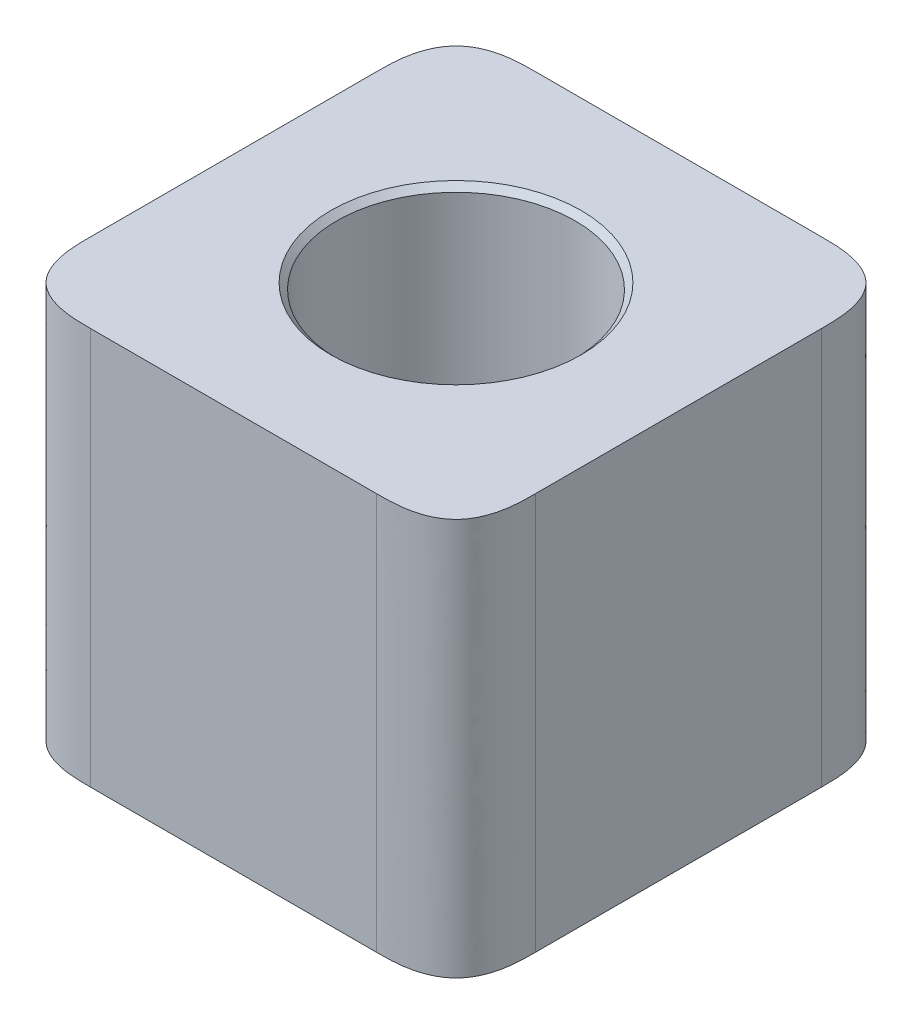
from build123d import *

# Parameters (mm, degrees)
SKETCH2_W                                       = 11.2
SKETCH2_H                                       = 11.2
SKETCH2_R                                       = 3
BOSS_EXTRUDE1_DEPTH                             = 9
SKETCH3_W                                       = 11.2
SKETCH3_H                                       = 11.2
BOSS_EXTRUDE2_DEPTH                             = 1
FILLET1_SIZE                                    = 2
CSK_FOR_M3_FLAT_HEAD_MACHINE_SCREW1_D           = 3.4
CSK_FOR_M3_FLAT_HEAD_MACHINE_SCREW1_DEPTH       = 9
CSK_FOR_M3_FLAT_HEAD_MACHINE_SCREW1_CSINK_D     = 6.3
CSK_FOR_M3_FLAT_HEAD_MACHINE_SCREW1_CSINK_ANGLE = 90


with BuildPart() as part:
    # Sketch2 → Boss-Extrude1 (new body)
    with BuildSketch(Plane(origin=(0, 0, 0), x_dir=(1, 0, 0), z_dir=(0, 1, 0))):
        Rectangle(SKETCH2_W, SKETCH2_H)
        with Locations(Location((0, 0, 0), (0, 0, 270))):
            Circle(SKETCH2_R, mode=Mode.SUBTRACT)
    extrude(amount=BOSS_EXTRUDE1_DEPTH)

    # Sketch3 → Boss-Extrude2 (add)
    with BuildSketch(Plane.XZ):
        Rectangle(SKETCH3_W, SKETCH3_H)
    extrude(amount=BOSS_EXTRUDE2_DEPTH)

    # Fillet1
    # a fillet whose section is not a circle: 2 mm, written as the material it takes off along each edge
    with BuildSketch(Plane(origin=(5.6, -6, 5.6), x_dir=(-1, 0, 0), z_dir=(0, 1, 0)), Plane(origin=(-5.6, 14, 5.6), x_dir=(1, 0, 0), z_dir=(0, -1, 0))) as fillet1_piece_1:
        with BuildLine():
            add(Edge.make_bspline([(FILLET1_SIZE, 0), (FILLET1_SIZE * 0.831801948466, 0), (FILLET1_SIZE * 0.663603896932, 0), (FILLET1_SIZE * 0.292893218813, -FILLET1_SIZE * 0.0716919198361), (FILLET1_SIZE * 0.0716919198361, -FILLET1_SIZE * 0.292893218813), (0, -FILLET1_SIZE * 0.663603896932), (0, -FILLET1_SIZE * 0.831801948466), (0, -FILLET1_SIZE)], knots=[0, 0, 0, 0, 0, 0, 0.5, 0.5, 1, 1, 1, 1, 1, 1], degree=5))
            Line((0, -FILLET1_SIZE), (0, 0))
            Line((0, 0), (FILLET1_SIZE, 0))
        make_face()
    extrude(amount=20, mode=Mode.SUBTRACT)
    with BuildSketch(Plane(origin=(-5.6, 14, -5.6), x_dir=(1, 0, 0), z_dir=(0, -1, 0)), Plane(origin=(5.6, -6, -5.6), x_dir=(-1, 0, 0), z_dir=(0, 1, 0))) as fillet1_piece_2:
        with BuildLine():
            add(Edge.make_bspline([(FILLET1_SIZE, 0), (FILLET1_SIZE * 0.831801948466, 0), (FILLET1_SIZE * 0.663603896932, 0), (FILLET1_SIZE * 0.292893218813, FILLET1_SIZE * 0.0716919198361), (FILLET1_SIZE * 0.0716919198361, FILLET1_SIZE * 0.292893218813), (0, FILLET1_SIZE * 0.663603896932), (0, FILLET1_SIZE * 0.831801948466), (0, FILLET1_SIZE)], knots=[0, 0, 0, 0, 0, 0, 0.5, 0.5, 1, 1, 1, 1, 1, 1], degree=5))
            Line((0, FILLET1_SIZE), (0, 0))
            Line((0, 0), (FILLET1_SIZE, 0))
        make_face()
    extrude(amount=20, mode=Mode.SUBTRACT)

    # CSK for M3 Flat Head Machine Screw1
    with Locations(Plane(origin=(0, 9, 0), x_dir=(1, 0, 0), z_dir=(0, 1, 0))):
        with Locations((0, 0)):
            CounterSinkHole(CSK_FOR_M3_FLAT_HEAD_MACHINE_SCREW1_D / 2, CSK_FOR_M3_FLAT_HEAD_MACHINE_SCREW1_CSINK_D / 2, depth=CSK_FOR_M3_FLAT_HEAD_MACHINE_SCREW1_DEPTH, counter_sink_angle=CSK_FOR_M3_FLAT_HEAD_MACHINE_SCREW1_CSINK_ANGLE)


solid = part.part
